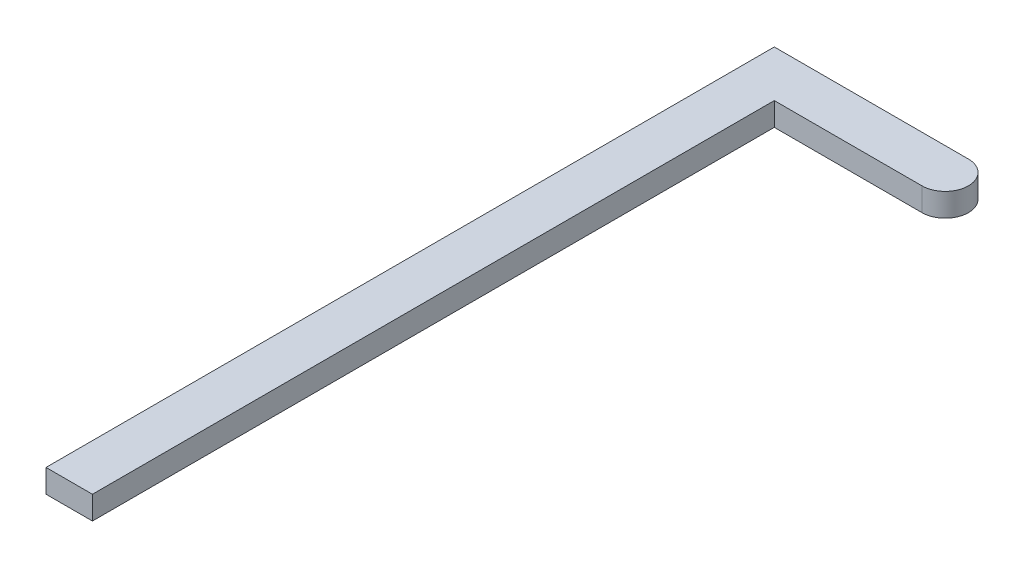
from build123d import *

# Parameters (mm, degrees)
BOSS_EXTRUDE1_DEPTH = 6.35


with BuildPart() as part:
    # Sketch1 → Boss-Extrude1 (new body)
    with BuildSketch(Plane(origin=(0, 0, 0), x_dir=(1, 0, 0), z_dir=(0, 1, 0))):
        with BuildLine():
            Line((0, 6.35), (-53.086, 6.35))
            Line((-53.086, 6.35), (-53.086, -192.786))
            Line((-53.086, -192.786), (-40.386, -192.786))
            Line((-40.386, -192.786), (-40.386, -6.35))
            Line((-40.386, -6.35), (0, -6.35))
            ThreePointArc((0, -6.35), (6.35, 0), (0, 6.35))
        make_face()
    extrude(amount=BOSS_EXTRUDE1_DEPTH)


solid = part.part
